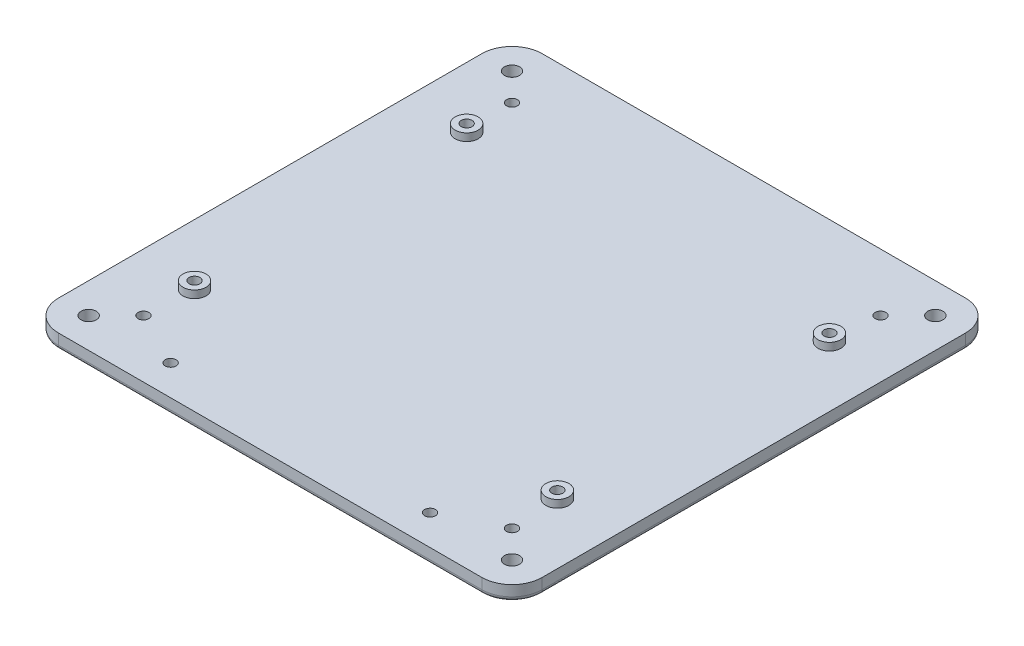
from build123d import *

# Parameters (mm, degrees)
SKETCH1_W           = 203.2
SKETCH1_H           = 203.2
BOSS_EXTRUDE1_DEPTH = 6.35
FILLET1_R           = 12.7
SKETCH2_R           = 3.175
CUT_EXTRUDE1_DEPTH  = 288.438345563
FILLET2_R           = 1.905
SKETCH3_R           = 2.286
CUT_EXTRUDE2_DEPTH  = 288.438345563
SKETCH4_R           = 2.286
CUT_EXTRUDE3_DEPTH  = 288.438345563
SKETCH5_R           = 4.826
SKETCH5_R_2         = 2.286
BOSS_EXTRUDE2_DEPTH = 3.175


with BuildPart() as part:
    # Sketch1 → Boss-Extrude1 (new body)
    with BuildSketch(Plane(origin=(0, 0, 0), x_dir=(1, 0, 0), z_dir=(0, 1, 0))):
        with Locations((101.6, 101.6)):
            Rectangle(SKETCH1_W, SKETCH1_H)
    extrude(amount=BOSS_EXTRUDE1_DEPTH)

    # Fillet1
    fillet1_edges = [part.edges().sort_by_distance(p)[0] for p in [
        (0, 3.175, -203.2),
        (0, 3.175, 0),
        (203.2, 3.175, 0),
        (203.2, 3.175, -203.2),
    ]]
    fillet(fillet1_edges, radius=FILLET1_R)

    # Sketch2 → Cut-Extrude1 (cut, through all)
    with BuildSketch(Plane.XZ):
        with Locations((12.7, -12.7)):
            Circle(SKETCH2_R)
        with Locations((190.5, -12.7)):
            Circle(SKETCH2_R)
        with Locations((190.5, -190.5)):
            Circle(SKETCH2_R)
        with Locations((12.7, -190.5)):
            Circle(SKETCH2_R)
    extrude(amount=-CUT_EXTRUDE1_DEPTH, mode=Mode.SUBTRACT)

    # Fillet2
    fillet2_edges = [part.edges().sort_by_distance(p)[0] for p in [
        (3.719743879, 0, -3.719743879),
        (101.6, 0, 0),
        (199.480256121, 0, -3.719743879),
        (203.2, 0, -101.6),
        (199.480256121, 0, -199.480256121),
        (101.6, 0, -203.2),
        (3.719743879, 0, -199.480256121),
        (0, 0, -101.6),
        (9.525, 0, -12.7),
        (187.325, 0, -12.7),
        (187.325, 0, -190.5),
        (9.525, 0, -190.5),
    ]]
    fillet(fillet2_edges, radius=FILLET2_R)

    # Sketch3 → Cut-Extrude2 (cut, through all)
    with BuildSketch(Plane(origin=(0, 6.35, 0), x_dir=(1, 0, 0), z_dir=(0, 1, 0))):
        with Locations((24.197781122, 24.197781122)):
            Circle(SKETCH3_R)
        with Locations((179.002218878, 179.002218878)):
            Circle(SKETCH3_R)
        with Locations((179.002218878, 24.197781122)):
            Circle(SKETCH3_R)
        with Locations((24.197781122, 179.002218878)):
            Circle(SKETCH3_R)
    extrude(amount=-CUT_EXTRUDE2_DEPTH, mode=Mode.SUBTRACT)

    # Sketch4 → Cut-Extrude3 (cut, through all)
    with BuildSketch(Plane(origin=(0, 6.35, 0), x_dir=(1, 0, 0), z_dir=(0, 1, 0))):
        with Locations((47.117, 12.7)):
            Circle(SKETCH4_R)
        with Locations((156.083, 12.7)):
            Circle(SKETCH4_R)
    extrude(amount=-CUT_EXTRUDE3_DEPTH, mode=Mode.SUBTRACT)

    # Sketch5 → Boss-Extrude2 (add)
    # profile 1 of 4: a face of its own
    with BuildSketch(Plane(origin=(0, 6.35, 0), x_dir=(1, 0, 0), z_dir=(0, 1, 0))):
        with Locations((25.4, 158.75)):
            Circle(SKETCH5_R)
        with Locations((25.4, 158.75)):
            Circle(SKETCH5_R_2, mode=Mode.SUBTRACT)
    # profile 2 of 4: a face of its own
    with BuildSketch(Plane(origin=(0, 6.35, 0), x_dir=(1, 0, 0), z_dir=(0, 1, 0))):
        with Locations((177.8, 158.75)):
            Circle(SKETCH5_R)
        with Locations((177.8, 158.75)):
            Circle(SKETCH5_R_2, mode=Mode.SUBTRACT)
    # profile 3 of 4: a face of its own
    with BuildSketch(Plane(origin=(0, 6.35, 0), x_dir=(1, 0, 0), z_dir=(0, 1, 0))):
        with Locations((177.8, 44.45)):
            Circle(SKETCH5_R)
        with Locations((177.8, 44.45)):
            Circle(SKETCH5_R_2, mode=Mode.SUBTRACT)
    # profile 4 of 4: a face of its own
    with BuildSketch(Plane(origin=(0, 6.35, 0), x_dir=(1, 0, 0), z_dir=(0, 1, 0))):
        with Locations((25.4, 44.45)):
            Circle(SKETCH5_R)
        with Locations((25.4, 44.45)):
            Circle(SKETCH5_R_2, mode=Mode.SUBTRACT)
    extrude(amount=BOSS_EXTRUDE2_DEPTH)


solid = part.part
